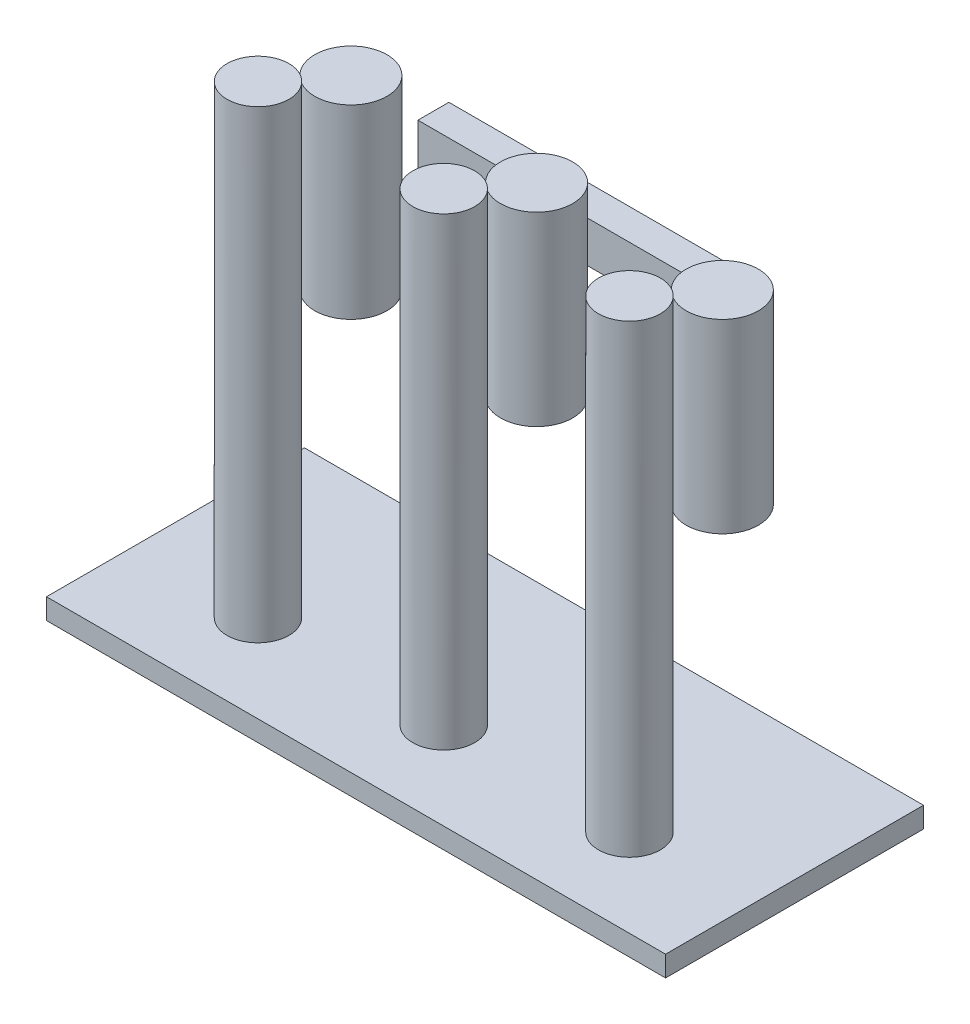
from build123d import *

# Parameters (mm, degrees)
SKETCH1_W           = 6000
SKETCH1_H           = 2500
BOSS_EXTRUDE1_DEPTH = 200
BOSS_EXTRUDE2_START = 200
SKETCH2_R           = 300
BOSS_EXTRUDE2_DEPTH = 4500
BOSS_EXTRUDE3_START = 2500
SKETCH3_R           = 350
BOSS_EXTRUDE3_DEPTH = 1800
BOSS_EXTRUDE4_START = 200
SKETCH4_R           = 300
BOSS_EXTRUDE4_DEPTH = 4500
BOSS_EXTRUDE5_START = 2500
SKETCH5_R           = 350
BOSS_EXTRUDE5_DEPTH = 1800
BOSS_EXTRUDE6_START = 200
SKETCH6_R           = 300
BOSS_EXTRUDE6_DEPTH = 4500
BOSS_EXTRUDE7_START = 2500
SKETCH7_R           = 350
BOSS_EXTRUDE7_DEPTH = 1800
BOSS_EXTRUDE8_START = 3500
SKETCH8_W           = 3000
SKETCH8_H           = 300
BOSS_EXTRUDE8_DEPTH = 400


with BuildPart() as part:
    # Sketch1 → Boss-Extrude1 (new body)
    with BuildSketch(Plane(origin=(0, 0, 0), x_dir=(1, 0, 0), z_dir=(0, 1, 0))):
        Rectangle(SKETCH1_W, SKETCH1_H)
    extrude(amount=BOSS_EXTRUDE1_DEPTH)

    # Sketch2 → Boss-Extrude2 (add)
    with BuildSketch(Plane(origin=(0, 0, 0), x_dir=(1, 0, 0), z_dir=(0, 1, 0)).offset(BOSS_EXTRUDE2_START)):
        with Locations((-1800, -400)):
            Circle(SKETCH2_R)
    extrude(amount=BOSS_EXTRUDE2_DEPTH)

    # Sketch4 → Boss-Extrude4 (add)
    with BuildSketch(Plane(origin=(0, 0, 0), x_dir=(1, 0, 0), z_dir=(0, 1, 0)).offset(BOSS_EXTRUDE4_START)):
        with Locations((0, -400)):
            Circle(SKETCH4_R)
    extrude(amount=BOSS_EXTRUDE4_DEPTH)

    # Sketch6 → Boss-Extrude6 (add)
    with BuildSketch(Plane(origin=(0, 0, 0), x_dir=(1, 0, 0), z_dir=(0, 1, 0)).offset(BOSS_EXTRUDE6_START)):
        with Locations((1800, -400)):
            Circle(SKETCH6_R)
    extrude(amount=BOSS_EXTRUDE6_DEPTH)


with BuildPart() as body_2:
    # Sketch3 → Boss-Extrude3 (new body)
    with BuildSketch(Plane(origin=(0, 0, 0), x_dir=(1, 0, 0), z_dir=(0, 1, 0)).offset(BOSS_EXTRUDE3_START)):
        with Locations((-1800, 500)):
            Circle(SKETCH3_R)
    extrude(amount=BOSS_EXTRUDE3_DEPTH)


with BuildPart() as body_3:
    # Sketch5 → Boss-Extrude5 (new body)
    with BuildSketch(Plane(origin=(0, 0, 0), x_dir=(1, 0, 0), z_dir=(0, 1, 0)).offset(BOSS_EXTRUDE5_START)):
        with Locations((0, 500)):
            Circle(SKETCH5_R)
    extrude(amount=BOSS_EXTRUDE5_DEPTH)


with BuildPart() as body_4:
    # Sketch7 → Boss-Extrude7 (new body)
    with BuildSketch(Plane(origin=(0, 0, 0), x_dir=(1, 0, 0), z_dir=(0, 1, 0)).offset(BOSS_EXTRUDE7_START)):
        with Locations((1800, 500)):
            Circle(SKETCH7_R)
    extrude(amount=BOSS_EXTRUDE7_DEPTH)


with BuildPart() as body_5:
    # Sketch8 → Boss-Extrude8 (new body)
    with BuildSketch(Plane(origin=(0, 0, 0), x_dir=(1, 0, 0), z_dir=(0, 1, 0)).offset(BOSS_EXTRUDE8_START)):
        with Locations((0, 1000)):
            Rectangle(SKETCH8_W, SKETCH8_H)
    extrude(amount=BOSS_EXTRUDE8_DEPTH)


solid = Compound([part.part, body_2.part, body_3.part, body_4.part, body_5.part])
